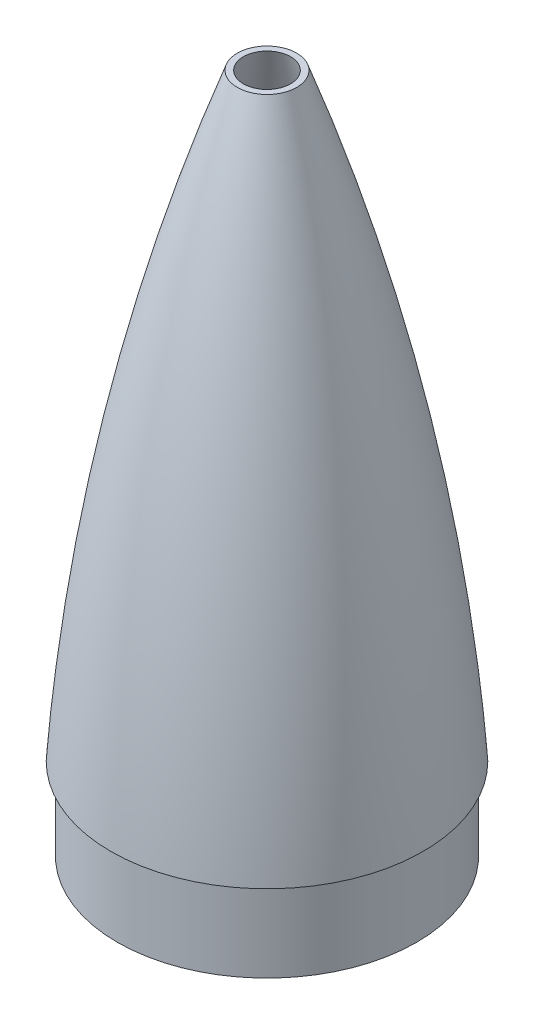
from build123d import *

# Parameters (mm, degrees)
SKETCH7_R           = 317.5
CUT_EXTRUDE2_DEPTH  = 88.9
SKETCH8_R           = 73.025
SKETCH8_R_2         = 69.85
BOSS_EXTRUDE1_DEPTH = 40


with BuildPart() as part:
    # Sketch2 → Revolve1 (revolve)
    with BuildSketch(Plane.XY):
        with BuildLine():
            Line((-76.2, 0), (-69.85, 0))
            ThreePointArc((-69.85, 0), (-46.178344337, 164.977710697), (0, 325.12))
            Line((0, 325.12), (0, 330.2))
            ThreePointArc((0, 330.2), (-50.970594074, 168.070137094), (-76.2, 0))
        make_face()
    revolve(axis=Axis((0, 330.2, 0), (0, -1, 0)))

    # Sketch7 → Cut-Extrude2 (cut)
    with BuildSketch(Plane(origin=(0, 381, 0), x_dir=(1, 0, 0), z_dir=(0, 1, 0))):
        Circle(SKETCH7_R)
    extrude(amount=-CUT_EXTRUDE2_DEPTH, mode=Mode.SUBTRACT)

    # Sketch8 → Boss-Extrude1 (add)
    with BuildSketch(Plane.XZ):
        Circle(SKETCH8_R)
        Circle(SKETCH8_R_2, mode=Mode.SUBTRACT)
    extrude(amount=BOSS_EXTRUDE1_DEPTH)


solid = part.part
